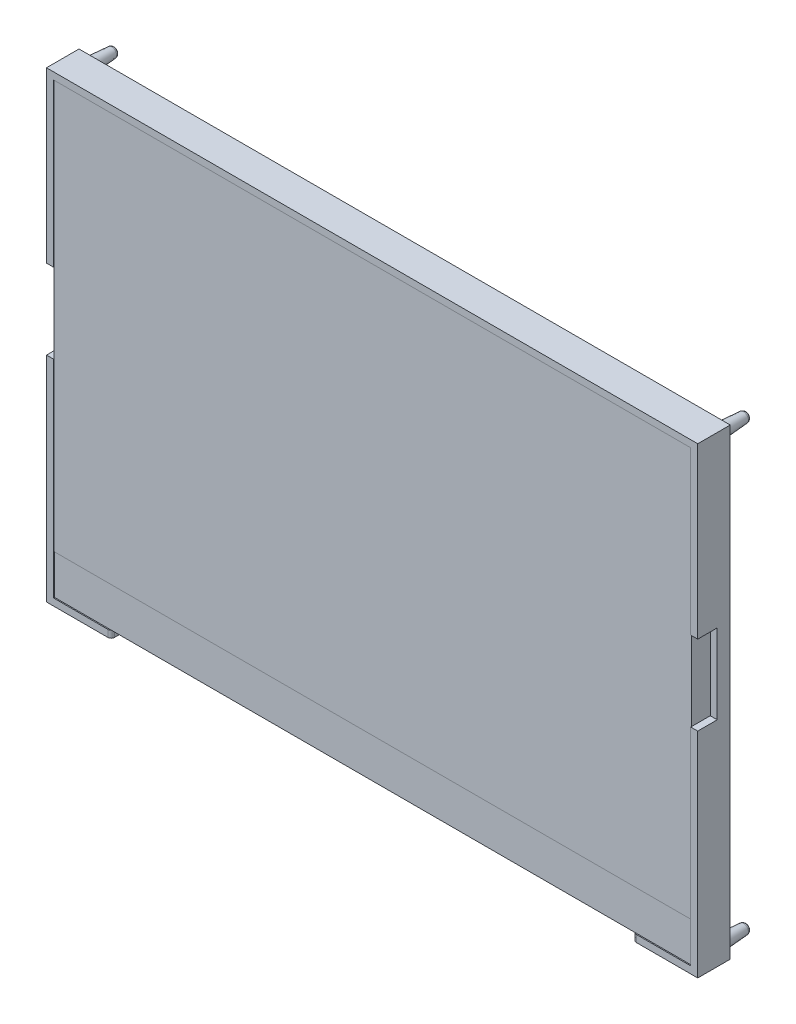
from build123d import *

# Parameters (mm, degrees)
ESQUISSE2_W                  = 100.15
ESQUISSE2_H                  = 71.15
BOSS_EXTRU_1_DEPTH           = 5
ESQUISSE3_W                  = 98
ESQUISSE3_H                  = 69
ENL_V_MAT_EXTRU_1_DEPTH      = 0.08
ESQUISSE4_W                  = 98
ESQUISSE4_H                  = 6.140882506
ENL_V_MAT_EXTRU_2_DEPTH      = 0.08
ESQUISSE5_W                  = 80.249689796
ESQUISSE5_H                  = 1.075
ENL_V_MAT_EXTRU_3_DEPTH      = 3
CONG_1_R                     = 0.5
CONG_2_R                     = 0.5
ESQUISSE7_W                  = 1.075
ESQUISSE7_H                  = 12.243191877
ENL_V_MAT_EXTRU_4_DEPTH      = 3
ESQUISSE8_R                  = 1
BOSS_EXTRU_3_DEPTH           = 4
BOSS_EXTRU_3_DRAFT           = 4
BOSS_EXTRU_3_PROFILE_2_DEPTH = 4
BOSS_EXTRU_3_PROFILE_2_DRAFT = 4
BOSS_EXTRU_3_PROFILE_3_DEPTH = 4
BOSS_EXTRU_3_PROFILE_3_DRAFT = 4
BOSS_EXTRU_3_PROFILE_4_DEPTH = 4
BOSS_EXTRU_3_PROFILE_4_DRAFT = 4
CONG_3_R                     = 0.5
CONG_4_R                     = 0.5
CONG_5_R                     = 0.5
CONG_6_R                     = 0.5
ESQUISSE9_R                  = 0.15
BOSS_EXTRU_5_DEPTH           = 4


with BuildPart() as part:
    # Esquisse2 → Boss.-Extru.1 (new body)
    with BuildSketch(Plane.XY):
        Rectangle(ESQUISSE2_W, ESQUISSE2_H)
    extrude(amount=BOSS_EXTRU_1_DEPTH)

    # Esquisse3 → Enlèv. mat.-Extru.1 (cut)
    with BuildSketch(Plane.XY.offset(5)):
        Rectangle(ESQUISSE3_W, ESQUISSE3_H)
    extrude(amount=-ENL_V_MAT_EXTRU_1_DEPTH, mode=Mode.SUBTRACT)

    # Esquisse4 → Enlèv. mat.-Extru.2 (cut)
    with BuildSketch(Plane.XY.offset(4.92)):
        with Locations((0, -31.429558747)):
            Rectangle(ESQUISSE4_W, ESQUISSE4_H)
    extrude(amount=-ENL_V_MAT_EXTRU_2_DEPTH, mode=Mode.SUBTRACT)

    # Esquisse5 → Enlèv. mat.-Extru.3 (cut)
    with BuildSketch(Plane.XY.offset(5)):
        with Locations((-0.000155102, -35.0375)):
            Rectangle(ESQUISSE5_W, ESQUISSE5_H)
    extrude(amount=-ENL_V_MAT_EXTRU_3_DEPTH, mode=Mode.SUBTRACT)

    # Congé1
    # the kernel refuses this fillet: 0.5 mm, written as the material it takes off along each edge
    with BuildSketch(Plane(origin=(-40.125, -36.825, 5), x_dir=(-1, 0, 0), z_dir=(0, 1, 0))) as cong_1_piece_1:
        with BuildLine():
            CenterArc((CONG_1_R, -CONG_1_R), CONG_1_R, 90, 90)
            Line((0, -CONG_1_R), (0, 0))
            Line((0, 0), (CONG_1_R, 0))
        make_face()
    extrude(amount=2.325, mode=Mode.SUBTRACT)

    # Congé2
    # the kernel refuses this fillet: 0.5 mm, written as the material it takes off along each edge
    with BuildSketch(Plane(origin=(40.124689796, -34.5, 5), x_dir=(0, 0, -1), z_dir=(0, -1, 0))) as cong_2_piece_1:
        with BuildLine():
            CenterArc((CONG_2_R, CONG_2_R), CONG_2_R, 180, 90)
            Line((0, CONG_2_R), (0, 0))
            Line((0, 0), (CONG_2_R, 0))
        make_face()
    extrude(amount=2.325, mode=Mode.SUBTRACT)

    # Esquisse7 → Enlèv. mat.-Extru.4 (cut)
    with BuildSketch(Plane.XY.offset(5)):
        with Locations((-49.5375, 3.433132672)):
            Rectangle(ESQUISSE7_W, ESQUISSE7_H)
        with Locations((49.5375, 3.433132672)):
            Rectangle(ESQUISSE7_W, ESQUISSE7_H)
    extrude(amount=-ENL_V_MAT_EXTRU_4_DEPTH, mode=Mode.SUBTRACT)


with BuildPart() as boss_extru_3_tool:
    # Esquisse8 → Boss.-Extru.3 (with draft: the straight prism first)
    with BuildSketch(Plane(origin=(0, 0, 0), x_dir=(-1, 0, 0), z_dir=(0, 0, -1))):
        with Locations((-48.577420287, -34.074984175)):
            Circle(ESQUISSE8_R)
    extrude(amount=BOSS_EXTRU_3_DEPTH)
    # Boss.-Extru.3: the draft: its side faces are tilted about the plane it starts from
    boss_extru_3_sides = [boss_extru_3_tool.faces().sort_by_distance(p)[0] for p in [
        (49.577420287, -34.074984175, -2),
    ]]
    draft(boss_extru_3_sides, Plane(origin=(0, 0, 0), x_dir=(-1, 0, 0), z_dir=(0, 0, -1)), BOSS_EXTRU_3_DRAFT)


with BuildPart() as part_1:
    add(part.part)

    # Boss.-Extru.3: add boss_extru_3_tool
    add(boss_extru_3_tool.part)


with BuildPart() as boss_extru_3_profile_2_tool:
    # Esquisse8 → Boss.-Extru.3 profile 2 (with draft: the straight prism first)
    with BuildSketch(Plane(origin=(0, 0, 0), x_dir=(-1, 0, 0), z_dir=(0, 0, -1))):
        with Locations((-48.577420287, 34.07588992)):
            Circle(ESQUISSE8_R)
    extrude(amount=BOSS_EXTRU_3_PROFILE_2_DEPTH)
    # Boss.-Extru.3 profile 2: the draft: its side faces are tilted about the plane it starts from
    boss_extru_3_profile_2_sides = [boss_extru_3_profile_2_tool.faces().sort_by_distance(p)[0] for p in [
        (49.577420287, 34.07588992, -2),
    ]]
    draft(boss_extru_3_profile_2_sides, Plane(origin=(0, 0, 0), x_dir=(-1, 0, 0), z_dir=(0, 0, -1)), BOSS_EXTRU_3_PROFILE_2_DRAFT)


with BuildPart() as part_2:
    add(part_1.part)

    # Boss.-Extru.3 profile 2: add boss_extru_3_profile_2_tool
    add(boss_extru_3_profile_2_tool.part)


with BuildPart() as boss_extru_3_profile_3_tool:
    # Esquisse8 → Boss.-Extru.3 profile 3 (with draft: the straight prism first)
    with BuildSketch(Plane(origin=(0, 0, 0), x_dir=(-1, 0, 0), z_dir=(0, 0, -1))):
        with Locations((48.578218454, 34.07588992)):
            Circle(ESQUISSE8_R)
    extrude(amount=BOSS_EXTRU_3_PROFILE_3_DEPTH)
    # Boss.-Extru.3 profile 3: the draft: its side faces are tilted about the plane it starts from
    boss_extru_3_profile_3_sides = [boss_extru_3_profile_3_tool.faces().sort_by_distance(p)[0] for p in [
        (-47.578218454, 34.07588992, -2),
    ]]
    draft(boss_extru_3_profile_3_sides, Plane(origin=(0, 0, 0), x_dir=(-1, 0, 0), z_dir=(0, 0, -1)), BOSS_EXTRU_3_PROFILE_3_DRAFT)


with BuildPart() as part_3:
    add(part_2.part)

    # Boss.-Extru.3 profile 3: add boss_extru_3_profile_3_tool
    add(boss_extru_3_profile_3_tool.part)


with BuildPart() as boss_extru_3_profile_4_tool:
    # Esquisse8 → Boss.-Extru.3 profile 4 (with draft: the straight prism first)
    with BuildSketch(Plane(origin=(0, 0, 0), x_dir=(-1, 0, 0), z_dir=(0, 0, -1))):
        with Locations((48.578218454, -34.074984175)):
            Circle(ESQUISSE8_R)
    extrude(amount=BOSS_EXTRU_3_PROFILE_4_DEPTH)
    # Boss.-Extru.3 profile 4: the draft: its side faces are tilted about the plane it starts from
    boss_extru_3_profile_4_sides = [boss_extru_3_profile_4_tool.faces().sort_by_distance(p)[0] for p in [
        (-47.578218454, -34.074984175, -2),
    ]]
    draft(boss_extru_3_profile_4_sides, Plane(origin=(0, 0, 0), x_dir=(-1, 0, 0), z_dir=(0, 0, -1)), BOSS_EXTRU_3_PROFILE_4_DRAFT)


with BuildPart() as part_4:
    add(part_3.part)

    # Boss.-Extru.3 profile 4: add boss_extru_3_profile_4_tool
    add(boss_extru_3_profile_4_tool.part)

    # Congé3
    cong_3_edges = [part_4.edges().sort_by_distance(p)[0] for p in [
        (49.297713039, 34.07588992, -4),
    ]]
    fillet(cong_3_edges, radius=CONG_3_R)

    # Congé4
    cong_4_edges = [part_4.edges().sort_by_distance(p)[0] for p in [
        (-47.857925701, 34.07588992, -4),
    ]]
    fillet(cong_4_edges, radius=CONG_4_R)

    # Congé5
    cong_5_edges = [part_4.edges().sort_by_distance(p)[0] for p in [
        (-47.857925701, -34.074984175, -4),
    ]]
    fillet(cong_5_edges, radius=CONG_5_R)

    # Congé6
    cong_6_edges = [part_4.edges().sort_by_distance(p)[0] for p in [
        (49.297713039, -34.074984175, -4),
    ]]
    fillet(cong_6_edges, radius=CONG_6_R)

    # Esquisse9 → Boss.-Extru.5 (add)
    with BuildSketch(Plane(origin=(0, 0, 0), x_dir=(-1, 0, 0), z_dir=(0, 0, -1))):
        with Locations((26.5, -34.476200763)):
            Circle(ESQUISSE9_R)
        with Locations((-26.5, -34.476200763)):
            Circle(ESQUISSE9_R)
    extrude(amount=BOSS_EXTRU_5_DEPTH)


solid = part_4.part
